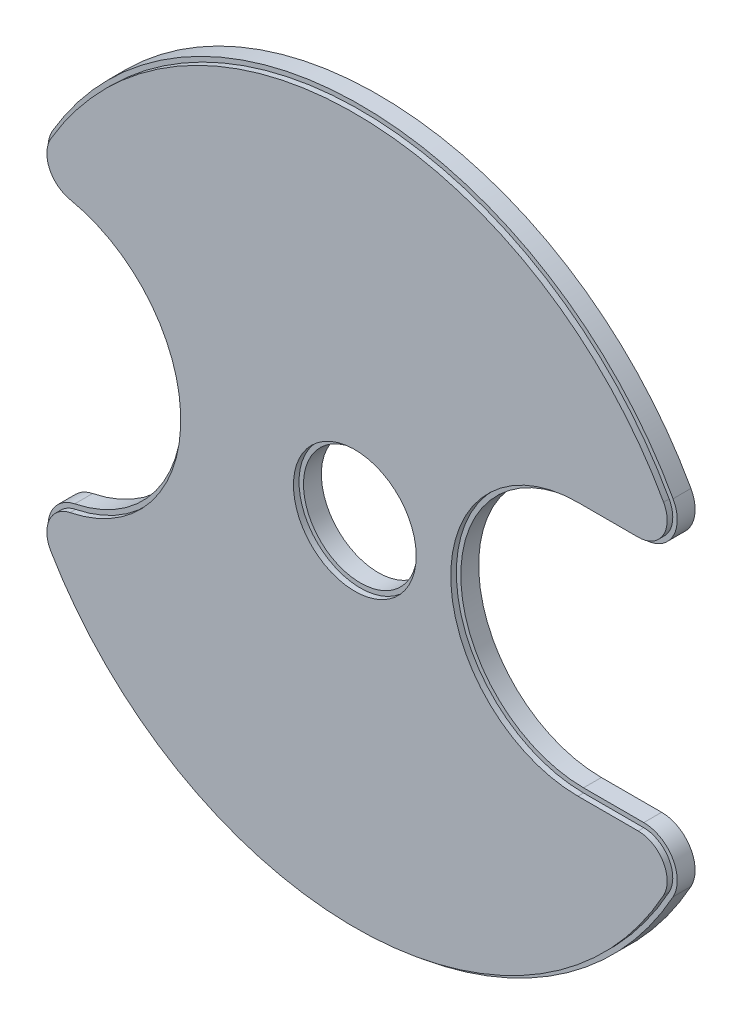
from build123d import *

# Parameters (mm, degrees)
ESQUISSE1_R        = 5.1
BOSS_EXTRU_1_DEPTH = 1.6
CONG_1_R           = 3
ESQUISSE2_R        = 5.5
BOSS_EXTRU_2_DEPTH = 0.5


with BuildPart() as part:
    # Esquisse1 → Boss.-Extru.1 (new body)
    with BuildSketch(Plane.XY):
        with BuildLine():
            Line((30.049958403, 11), (20, 11))
            ThreePointArc((20, 11), (9, 0), (20, -11))
            Line((20, -11), (30.049958403, -11))
            ThreePointArc((30.049958403, -11), (0.469484965, -31.996555813), (-29.714285714, -11.876919823))
            ThreePointArc((-29.714285714, -11.876919823), (-16, 0), (-29.714285714, 11.876919823))
            ThreePointArc((-29.714285714, 11.876919823), (0.469484965, 31.996555813), (30.049958403, 11))
        make_face()
        Circle(ESQUISSE1_R, mode=Mode.SUBTRACT)
    extrude(amount=BOSS_EXTRU_1_DEPTH)

    # Congé1
    cong_1_edges = [part.edges().sort_by_distance(p)[0] for p in [
        (-29.714285714, -11.876919823, 0.8),
        (-29.714285714, 11.876919823, 0.8),
        (30.049958403, -11, 0.8),
        (30.049958403, 11, 0.8),
    ]]
    fillet(cong_1_edges, radius=CONG_1_R)

    # Esquisse2 → Boss.-Extru.2 (add)
    with BuildSketch(Plane.XY.offset(1.6)):
        with BuildLine():
            Line((20, 11.4), (25.396850198, 11.4))
            ThreePointArc((25.396850198, 11.4), (27.635538238, 12.677776168), (27.673809182, 15.255172414))
            ThreePointArc((27.673809182, 15.255172414), (0.43695488, 31.596978818), (-27.24137931, 16.014595008))
            ThreePointArc((-27.24137931, 16.014595008), (-27.375100724, 13.639159391), (-25.52, 12.149469124))
            ThreePointArc((-25.52, 12.149469124), (-15.6, 0), (-25.52, -12.149469124))
            ThreePointArc((-25.52, -12.149469124), (-27.375100724, -13.639159391), (-27.24137931, -16.014595008))
            ThreePointArc((-27.24137931, -16.014595008), (0.43695488, -31.596978818), (27.673809182, -15.255172414))
            ThreePointArc((27.673809182, -15.255172414), (27.635538238, -12.677776168), (25.396850198, -11.4))
            Line((25.396850198, -11.4), (20, -11.4))
            ThreePointArc((20, -11.4), (8.6, 0), (20, 11.4))
        make_face()
        Circle(ESQUISSE2_R, mode=Mode.SUBTRACT)
    extrude(amount=BOSS_EXTRU_2_DEPTH)


solid = part.part
